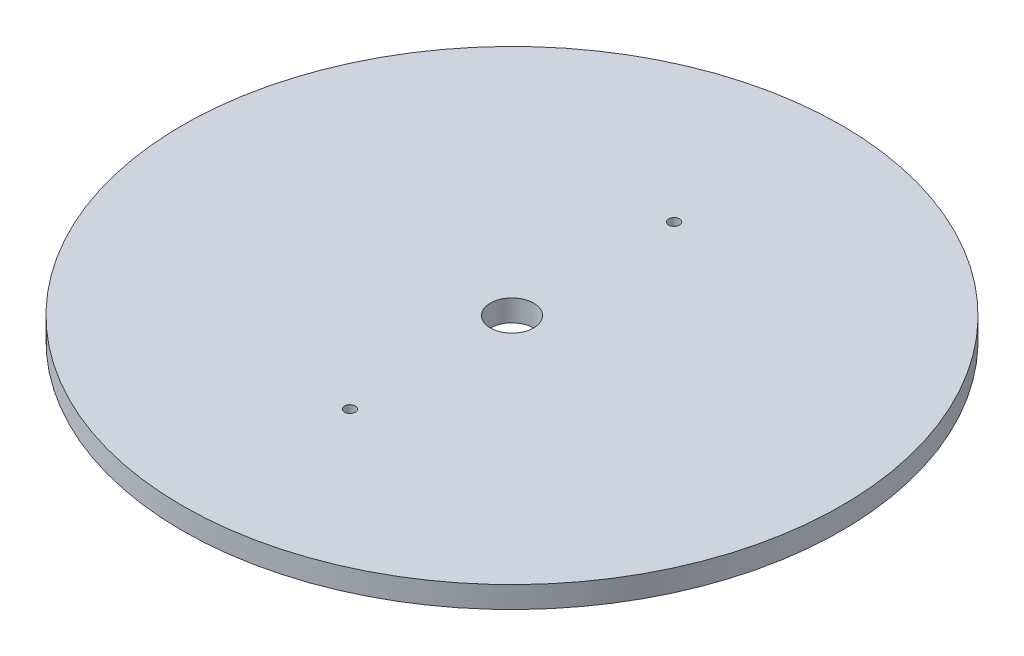
from build123d import *

# Parameters (mm, degrees)
SKETCH1_R           = 30.5
BOSS_EXTRUDE1_DEPTH = 2
SKETCH2_R           = 2
CUT_EXTRUDE1_DEPTH  = 44.179856415
SKETCH4_R           = 0.5
CUT_EXTRUDE2_DEPTH  = 44.179856415
CUT_EXTRUDE3_DEPTH  = 0.5


with BuildPart() as part:
    # Sketch1 → Boss-Extrude1 (new body)
    with BuildSketch(Plane(origin=(0, 0, 0), x_dir=(1, 0, 0), z_dir=(0, 1, 0))):
        Circle(SKETCH1_R)
    extrude(amount=BOSS_EXTRUDE1_DEPTH)

    # Sketch2 → Cut-Extrude1 (cut, through all)
    with BuildSketch(Plane(origin=(0, 2, 0), x_dir=(1, 0, 0), z_dir=(0, 1, 0))):
        Circle(SKETCH2_R)
    extrude(amount=-CUT_EXTRUDE1_DEPTH, mode=Mode.SUBTRACT)

    # Sketch4 → Cut-Extrude2 (cut, through all)
    with BuildSketch(Plane(origin=(0, 2, 0), x_dir=(1, 0, 0), z_dir=(0, 1, 0))):
        with Locations((0, 15)):
            Circle(SKETCH4_R)
        with Locations((0, -15)):
            Circle(SKETCH4_R)
    extrude(amount=-CUT_EXTRUDE2_DEPTH, mode=Mode.SUBTRACT)

    # Sketch5 → Cut-Extrude3 (cut)
    with BuildSketch(Plane.XZ):
        with BuildLine():
            Line((0.599999999, 26), (0.599999999, 15))
            ThreePointArc((0.599999999, 15), (0, 14.400000002), (-0.599999999, 15))
            Line((-0.599999999, 15), (-0.599999999, 26))
            ThreePointArc((-0.599999999, 26), (0, 26.599999999), (0.599999999, 26))
        make_face()
        with BuildLine():
            Line((0.599999999, -26), (0.599999999, -15.000000001))
            ThreePointArc((0.599999999, -15.000000001), (0, -14.400000003), (-0.599999999, -15.000000001))
            Line((-0.599999999, -15.000000001), (-0.599999999, -26))
            ThreePointArc((-0.599999999, -26), (0, -26.6), (0.599999999, -26))
        make_face()
    extrude(amount=-CUT_EXTRUDE3_DEPTH, mode=Mode.SUBTRACT)


solid = part.part
